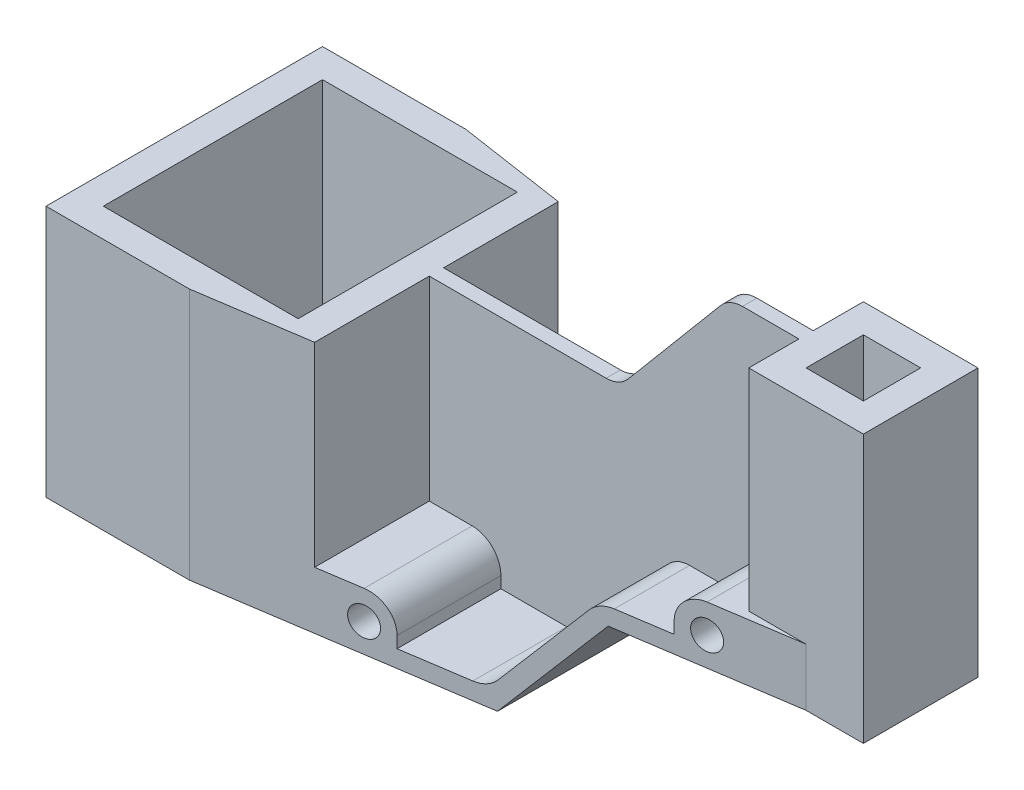
from build123d import *

# Parameters (mm, degrees)
SKETCH1_W           = 257
SKETCH1_H           = 133.5
BOSS_EXTRUDE1_DEPTH = 96.5
SKETCH2_W           = 113
SKETCH2_H           = 45.5
SKETCH2_W_2         = 80
SKETCH2_H_2         = 40
CUT_EXTRUDE1_DEPTH  = 96.5
CUT_EXTRUDE2_DEPTH  = 88
SKETCH6_W           = 20
SKETCH6_H           = 28.25
CUT_EXTRUDE3_DEPTH  = 93.5
SKETCH7_W           = 124
SKETCH7_H           = 28.25
CUT_EXTRUDE4_DEPTH  = 73.5
SKETCH8_W           = 104
SKETCH8_H           = 17.5
CUT_EXTRUDE5_DEPTH  = 73.5
SKETCH9_W           = 25
SKETCH9_H           = 45.75
CUT_EXTRUDE6_DEPTH  = 68
SKETCH11_W          = 84
SKETCH11_H          = 45.75
CUT_EXTRUDE7_DEPTH  = 14
SKETCH12_W          = 84
SKETCH12_H          = 45.75
CUT_EXTRUDE8_DEPTH  = 14
CUT_EXTRUDE10_DEPTH = 45.75
CUT_EXTRUDE11_DEPTH = 96.5
CUT_EXTRUDE12_DEPTH = 45.75
CUT_EXTRUDE13_DEPTH = 5
SKETCH18_R          = 5
CUT_EXTRUDE14_DEPTH = 96.5
SKETCH19_W          = 20
SKETCH19_H          = 20
CUT_EXTRUDE15_DEPTH = 93.5
CUT_EXTRUDE42_DEPTH = 88
CUT_EXTRUDE53_DEPTH = 20
CUT_EXTRUDE61_DEPTH = 50.68
CUT_EXTRUDE62_DEPTH = 88
CUT_EXTRUDE63_DEPTH = 88
CUT_EXTRUDE64_DEPTH = 88
FILLET2_R           = 10
FILLET3_R           = 10
FILLET4_R           = 10
FILLET5_R           = 10
FILLET6_R           = 10
FILLET7_R           = 10
FILLET8_R           = 10
FILLET9_R           = 10
FILLET10_R          = 10
FILLET11_R          = 10


with BuildPart() as part:
    # Sketch1 → Boss-Extrude1 (new body)
    with BuildSketch(Plane.XY):
        with Locations((93.989304803, 40.957796221)):
            Rectangle(SKETCH1_W, SKETCH1_H)
    extrude(amount=BOSS_EXTRUDE1_DEPTH)

    # Sketch2 → Cut-Extrude1 (cut)
    with BuildSketch(Plane.XY.offset(96.5)):
        with Locations((21.989304803, 84.957796221)):
            Rectangle(SKETCH2_W, SKETCH2_H)
        with Locations((182.489304803, -5.792203779)):
            Rectangle(SKETCH2_W_2, SKETCH2_H_2)
    extrude(amount=-CUT_EXTRUDE1_DEPTH, mode=Mode.SUBTRACT)

    # Sketch4 → Cut-Extrude2 (cut)
    with BuildSketch(Plane(origin=(0, 62.207796221, 0), x_dir=(1, 0, 0), z_dir=(0, 1, 0))):
        Polygon((-24.510695197, -10), (-24.510695197, -48.25), (-24.510695197, -86.5), (43.489304803, -86.5), (43.489304803, -48.25), (43.489304803, -10), align=None)
    extrude(amount=-CUT_EXTRUDE2_DEPTH, mode=Mode.SUBTRACT)

    # Sketch6 → Cut-Extrude3 (cut)
    with BuildSketch(Plane(origin=(0, 107.707796221, 0), x_dir=(1, 0, 0), z_dir=(0, 1, 0))):
        with Locations((212.489304803, -14.125)):
            Rectangle(SKETCH6_W, SKETCH6_H)
        with Locations((212.489304803, -82.375)):
            Rectangle(SKETCH6_W, SKETCH6_H)
    extrude(amount=-CUT_EXTRUDE3_DEPTH, mode=Mode.SUBTRACT)

    # Sketch7 → Cut-Extrude4 (cut)
    with BuildSketch(Plane(origin=(0, 107.707796221, 0), x_dir=(1, 0, 0), z_dir=(0, 1, 0))):
        with Locations((140.489304803, -14.125)):
            Rectangle(SKETCH7_W, SKETCH7_H)
        with Locations((140.489304803, -82.375)):
            Rectangle(SKETCH7_W, SKETCH7_H)
    extrude(amount=-CUT_EXTRUDE4_DEPTH, mode=Mode.SUBTRACT)

    # Sketch8 → Cut-Extrude5 (cut)
    with BuildSketch(Plane(origin=(0, 107.707796221, 0), x_dir=(1, 0, 0), z_dir=(0, 1, 0))):
        with Locations((130.489304803, -37)):
            Rectangle(SKETCH8_W, SKETCH8_H)
        with Locations((130.489304803, -59.5)):
            Rectangle(SKETCH8_W, SKETCH8_H)
    extrude(amount=-CUT_EXTRUDE5_DEPTH, mode=Mode.SUBTRACT)

    # Sketch9 → Cut-Extrude6 (cut)
    with BuildSketch(Plane(origin=(0, 62.207796221, 0), x_dir=(1, 0, 0), z_dir=(0, 1, 0))):
        with Locations((65.989304803, -73.625)):
            Rectangle(SKETCH9_W, SKETCH9_H)
        with Locations((65.989304803, -22.875)):
            Rectangle(SKETCH9_W, SKETCH9_H)
    extrude(amount=-CUT_EXTRUDE6_DEPTH, mode=Mode.SUBTRACT)

    # Sketch11 → Cut-Extrude7 (cut)
    with BuildSketch(Plane(origin=(0, 34.207796221, 0), x_dir=(1, 0, 0), z_dir=(0, 1, 0))):
        with Locations((120.489304803, -73.625)):
            Rectangle(SKETCH11_W, SKETCH11_H)
    extrude(amount=-CUT_EXTRUDE7_DEPTH, mode=Mode.SUBTRACT)

    # Sketch12 → Cut-Extrude8 (cut)
    with BuildSketch(Plane(origin=(0, 34.207796221, 0), x_dir=(1, 0, 0), z_dir=(0, 1, 0))):
        with Locations((120.489304803, -22.875)):
            Rectangle(SKETCH12_W, SKETCH12_H)
    extrude(amount=-CUT_EXTRUDE8_DEPTH, mode=Mode.SUBTRACT)

    # Sketch13 → Cut-Extrude10 (cut)
    with BuildSketch(Plane.XY.offset(96.5)):
        Polygon((139.691458854, 20.207796221), (106.127473607, -19.792203779), (78.489304803, -19.792203779), (78.489304803, 20.207796221), align=None)
    extrude(amount=-CUT_EXTRUDE10_DEPTH, mode=Mode.SUBTRACT)

    # Sketch15 → Cut-Extrude11 (cut)
    with BuildSketch(Plane.XY.offset(96.5)):
        Polygon((142.489304803, 14.207796221), (108.925319556, -25.792203779), (142.489304803, -25.792203779), align=None)
    extrude(amount=-CUT_EXTRUDE11_DEPTH, mode=Mode.SUBTRACT)

    # Sketch16 → Cut-Extrude12 (cut)
    with BuildSketch(Plane(origin=(0, 0, 0), x_dir=(-1, 0, 0), z_dir=(0, 0, -1))):
        Polygon((-78.489304803, -19.792203779), (-106.127473607, -19.792203779), (-139.691458854, 20.207796221), (-78.489304803, 20.207796221), align=None)
    extrude(amount=-CUT_EXTRUDE12_DEPTH, mode=Mode.SUBTRACT)

    # Sketch17 → Cut-Extrude13 (cut)
    with BuildSketch(Plane.XY.offset(50.75)):
        Polygon((78.489304803, 62.207796221), (119.862118509, 62.207796221), (158.148215693, 107.707796221), (78.489304803, 107.707796221), align=None)
    extrude(amount=-CUT_EXTRUDE13_DEPTH, mode=Mode.SUBTRACT)

    # Sketch18 → Cut-Extrude14 (cut)
    with BuildSketch(Plane.XY.offset(96.5)):
        with Locations((172.489304803, 24.207796221)):
            Circle(SKETCH18_R)
        with Locations((68.489304803, -15.792203779)):
            Circle(SKETCH18_R)
    extrude(amount=-CUT_EXTRUDE14_DEPTH, mode=Mode.SUBTRACT)

    # Sketch19 → Cut-Extrude15 (cut)
    with BuildSketch(Plane(origin=(0, 107.707796221, 0), x_dir=(1, 0, 0), z_dir=(0, 1, 0))):
        with Locations((202.489304803, -48.25)):
            Rectangle(SKETCH19_W, SKETCH19_H)
    extrude(amount=-CUT_EXTRUDE15_DEPTH, mode=Mode.SUBTRACT)

    # Sketch51 → Cut-Extrude42 (cut)
    with BuildSketch(Plane(origin=(0, 62.207796221, 0), x_dir=(1, 0, 0), z_dir=(0, 1, 0))):
        Polygon((15.489304803, -96.5), (53.489304803, -96.5), (53.489304803, -90.759358289), align=None)
    extrude(amount=-CUT_EXTRUDE42_DEPTH, mode=Mode.SUBTRACT)

    # Sketch62 → Cut-Extrude53 (cut)
    with BuildSketch(Plane.XZ.offset(-14.207796221)):
        Polygon((142.489304803, 96.5), (202.489304803, 96.5), (202.489304803, 68.25), (142.489304803, 77.314171123), align=None)
    extrude(amount=-CUT_EXTRUDE53_DEPTH, mode=Mode.SUBTRACT)

    # Sketch75 → Cut-Extrude61 (cut)
    with BuildSketch(Plane.XZ.offset(25.792203779)):
        Polygon((142.489304803, 77.314171123), (53.489304803, 90.759358289), (53.489304803, 96.5), (142.489304803, 96.5), align=None)
    extrude(amount=-CUT_EXTRUDE61_DEPTH, mode=Mode.SUBTRACT)

    # Sketch79 → Cut-Extrude62 (cut)
    with BuildSketch(Plane(origin=(0, 62.207796221, 0), x_dir=(1, 0, 0), z_dir=(0, 1, 0))):
        Polygon((15.489304803, 0), (53.489304803, 0), (53.489304803, -5.740641711), align=None)
    extrude(amount=-CUT_EXTRUDE62_DEPTH, mode=Mode.SUBTRACT)

    # Sketch80 → Cut-Extrude63 (cut)
    with BuildSketch(Plane.XZ.offset(25.792203779)):
        Polygon((53.489304803, 5.740641711), (53.489304803, 0), (142.489304803, 0), (142.489304803, 19.185828877), align=None)
    extrude(amount=-CUT_EXTRUDE63_DEPTH, mode=Mode.SUBTRACT)

    # Sketch81 → Cut-Extrude64 (cut)
    with BuildSketch(Plane.XZ.offset(-14.207796221)):
        Polygon((142.489304803, 19.185828877), (202.489304803, 28.25), (202.489304803, 0), (142.489304803, 0), align=None)
    extrude(amount=-CUT_EXTRUDE64_DEPTH, mode=Mode.SUBTRACT)

    # Fillet2
    fillet2_edges = [part.edges().sort_by_distance(p)[0] for p in [
        (162.489304803, 34.207796221, 62.521390374),
    ]]
    fillet(fillet2_edges, radius=FILLET2_R)

    # Fillet3
    fillet3_edges = [part.edges().sort_by_distance(p)[0] for p in [
        (162.489304803, 34.207796221, 33.978609626),
    ]]
    fillet(fillet3_edges, radius=FILLET3_R)

    # Fillet4
    fillet4_edges = [part.edges().sort_by_distance(p)[0] for p in [
        (139.691458854, 20.207796221, 32.256579818),
    ]]
    fillet(fillet4_edges, radius=FILLET4_R)

    # Fillet5
    fillet5_edges = [part.edges().sort_by_distance(p)[0] for p in [
        (139.691458854, 20.207796221, 64.243420182),
    ]]
    fillet(fillet5_edges, radius=FILLET5_R)

    # Fillet6
    fillet6_edges = [part.edges().sort_by_distance(p)[0] for p in [
        (106.127473607, -19.792203779, 66.778667731),
    ]]
    fillet(fillet6_edges, radius=FILLET6_R)

    # Fillet7
    fillet7_edges = [part.edges().sort_by_distance(p)[0] for p in [
        (106.127473607, -19.792203779, 29.721332269),
    ]]
    fillet(fillet7_edges, radius=FILLET7_R)

    # Fillet8
    fillet8_edges = [part.edges().sort_by_distance(p)[0] for p in [
        (78.489304803, -5.792203779, 68.86631016),
    ]]
    fillet(fillet8_edges, radius=FILLET8_R)

    # Fillet9
    fillet9_edges = [part.edges().sort_by_distance(p)[0] for p in [
        (78.489304803, -5.792203779, 27.63368984),
    ]]
    fillet(fillet9_edges, radius=FILLET9_R)

    # Fillet10
    fillet10_edges = [part.edges().sort_by_distance(p)[0] for p in [
        (158.148215693, 107.707796221, 48.25),
    ]]
    fillet(fillet10_edges, radius=FILLET10_R)

    # Fillet11
    fillet11_edges = [part.edges().sort_by_distance(p)[0] for p in [
        (119.862118509, 62.207796221, 48.25),
    ]]
    fillet(fillet11_edges, radius=FILLET11_R)


solid = part.part
